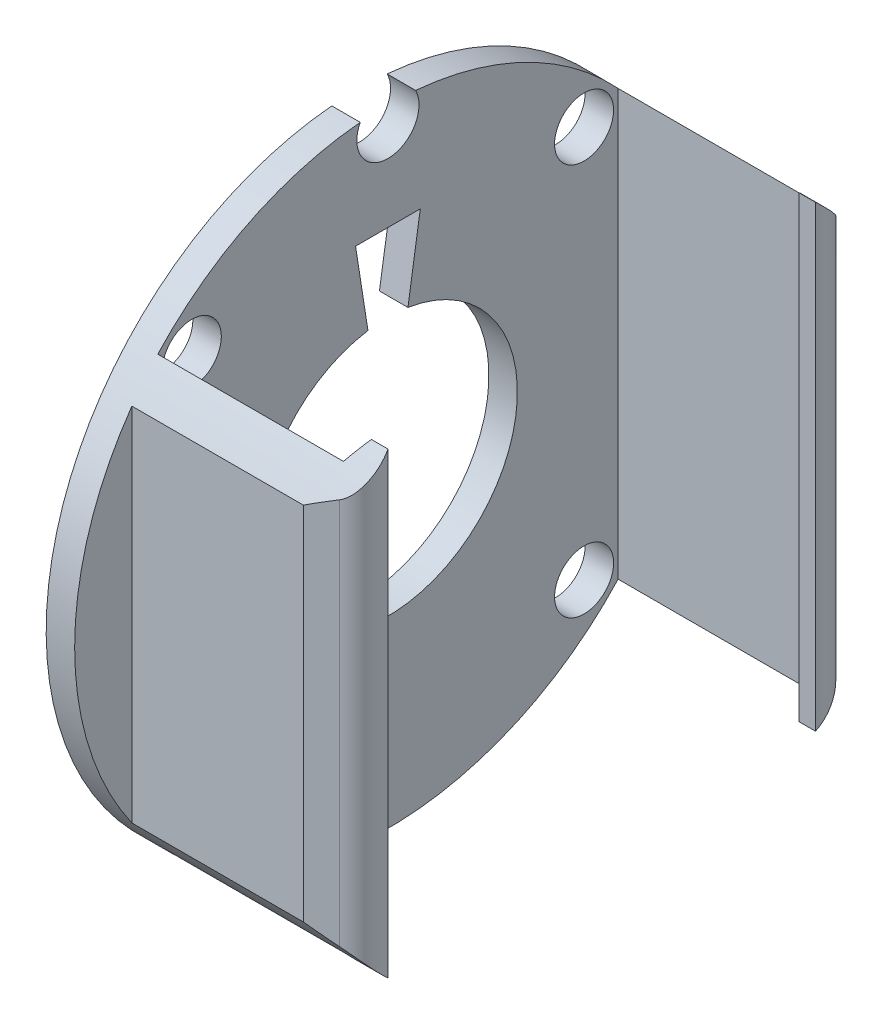
from build123d import *

# Parameters (mm, degrees)
SKETCH1_R           = 60.5
BOSS_EXTRUDE1_DEPTH = 5.5
SKETCH2_R           = 5.7
SKETCH2_R_2         = 25
CUT_EXTRUDE1_DEPTH  = 86.736514975
BOSS_EXTRUDE2_DEPTH = 38.1
BOSS_EXTRUDE3_DEPTH = 5
CHAMFER1_SIZE       = 10
CHAMFER1_SIZE_2     = 3.639702343
CHAMFER2_SIZE       = 10
CHAMFER2_SIZE2      = 3.639702343
CHAMFER3_SIZE       = 1.819851171
CHAMFER3_SIZE_2     = 5
CHAMFER4_SIZE       = 5
CHAMFER4_SIZE_2     = 1.819851171
FILLET1_R           = 5
CHAMFER5_SIZE       = 3.213333015
CHAMFER5_SIZE_2     = 2.25
CHAMFER6_SIZE       = 2.25
CHAMFER6_SIZE_2     = 3.213333015
SKETCH5_R           = 6
CUT_EXTRUDE2_DEPTH  = 96.112299108


with BuildPart() as part:
    # Sketch1 → Boss-Extrude1 (new body)
    with BuildSketch(Plane(origin=(0, 0, 0), x_dir=(0, 0, -1), z_dir=(1, 0, 0))):
        Circle(SKETCH1_R)
    extrude(amount=BOSS_EXTRUDE1_DEPTH)

    # Sketch2 → Cut-Extrude1 (cut, through all)
    with BuildSketch(Plane(origin=(5.5, 0, 0), x_dir=(0, 0, -1), z_dir=(1, 0, 0))):
        with Locations((-37.875, 37.875)):
            Circle(SKETCH2_R)
        with Locations(Location((37.875, 37.875, 0), (0, 0, 180))):
            Circle(SKETCH2_R)
        with Locations((37.875, -37.875)):
            Circle(SKETCH2_R)
        with Locations(Location((-37.875, -37.875, 0), (0, 0, 180))):
            Circle(SKETCH2_R)
        Circle(SKETCH2_R_2)
    extrude(amount=-CUT_EXTRUDE1_DEPTH, mode=Mode.SUBTRACT)

    # Sketch3 → Boss-Extrude2 (add)
    with BuildSketch(Plane(origin=(5.5, 0, 0), x_dir=(0, 0, -1), z_dir=(1, 0, 0))):
        with BuildLine():
            ThreePointArc((-44.45, 41.042021149), (-47.05176845, 38.03131717), (-49.45, 34.856097028))
            Line((-49.45, 34.856097028), (-49.45, -34.856097028))
            ThreePointArc((-49.45, -34.856097028), (-47.05176845, -38.03131717), (-44.45, -41.042021149))
            Line((-44.45, -41.042021149), (-44.45, 41.042021149))
        make_face()
        with BuildLine():
            ThreePointArc((49.45, 34.856097028), (47.05176845, 38.03131717), (44.45, 41.042021149))
            Line((44.45, 41.042021149), (44.45, -41.042021149))
            ThreePointArc((44.45, -41.042021149), (47.05176845, -38.03131717), (49.45, -34.856097028))
            Line((49.45, -34.856097028), (49.45, 34.856097028))
        make_face()
    extrude(amount=BOSS_EXTRUDE2_DEPTH)

    # Sketch4 → Boss-Extrude3 (add)
    with BuildSketch(Plane(origin=(43.6, 0, 0), x_dir=(0, 0, -1), z_dir=(1, 0, 0))):
        with BuildLine():
            Line((-41.275, -44.233747015), (-41.275, 44.233747015))
            ThreePointArc((-41.275, 44.233747015), (-42.892198414, 42.667426865), (-44.45, 41.042021149))
            Line((-44.45, 41.042021149), (-44.45, -41.042021149))
            ThreePointArc((-44.45, -41.042021149), (-42.892198414, -42.667426865), (-41.275, -44.233747015))
        make_face()
        with BuildLine():
            Line((-49.45, 34.856097028), (-49.45, -34.856097028))
            ThreePointArc((-49.45, -34.856097028), (-47.05176845, -38.03131717), (-44.45, -41.042021149))
            Line((-44.45, -41.042021149), (-44.45, 41.042021149))
            ThreePointArc((-44.45, 41.042021149), (-47.05176845, 38.03131717), (-49.45, 34.856097028))
        make_face()
        with BuildLine():
            Line((49.45, -34.856097028), (49.45, 34.856097028))
            ThreePointArc((49.45, 34.856097028), (45.604182769, 39.755609842), (41.275, 44.233747015))
            Line((41.275, 44.233747015), (41.275, -44.233747015))
            ThreePointArc((41.275, -44.233747015), (45.604182769, -39.755609842), (49.45, -34.856097028))
        make_face()
    extrude(amount=BOSS_EXTRUDE3_DEPTH)

    # Chamfer1
    # the kernel refuses this chamfer: 10, 3.639702343 mm, written as the material it takes off along each edge
    with BuildSketch(Plane(origin=(48.6, 60.798044353, 49.45), x_dir=(-0.9999130865277315, 0, 0.013184058198646176), z_dir=(0, -1, 0))) as chamfer1_piece_1:
        Polygon((CHAMFER1_SIZE * 0.999913086528, CHAMFER1_SIZE * 0.0131840581986), (-CHAMFER1_SIZE_2 * 0.0131840581974, CHAMFER1_SIZE_2 * 0.999913086435), (0, 0), align=None)
    extrude(amount=121.596088706, mode=Mode.SUBTRACT)

    # Chamfer2
    chamfer2_edges = [part.edges().sort_by_distance(p)[0] for p in [
        (48.6, 0, -49.45),
    ]]
    chamfer2_side = [part.faces().sort_by_distance(p)[0] for p in [
        (27.05, 0, -49.45),
    ]]
    chamfer(chamfer2_edges, length=CHAMFER2_SIZE, length2=CHAMFER2_SIZE2, reference=chamfer2_side[0])

    # Chamfer3
    # the kernel refuses this chamfer: 5, 1.819851171 mm, written as the material it takes off along each edge
    with BuildSketch(Plane(origin=(48.6, -57.204720678, 41.275), x_dir=(-0.9950833631817487, 0, -0.09904090225204971), z_dir=(0, 1, 0))) as chamfer3_piece_1:
        Polygon((CHAMFER3_SIZE * 0.995083363363, CHAMFER3_SIZE * 0.0990409022701), (-CHAMFER3_SIZE_2 * 0.099040902252, CHAMFER3_SIZE_2 * 0.995083363182), (0, 0), align=None)
    extrude(amount=114.409441356, mode=Mode.SUBTRACT)

    # Chamfer4
    # the kernel refuses this chamfer: 5, 1.819851171 mm, written as the material it takes off along each edge
    with BuildSketch(Plane(origin=(48.6, 57.204720678, -41.275), x_dir=(0.013184058198646176, 0, -0.9999130865277315), z_dir=(0, -1, 0))) as chamfer4_piece_1:
        Polygon((CHAMFER4_SIZE * 0.999913086528, -CHAMFER4_SIZE * 0.0131840581986), (-CHAMFER4_SIZE_2 * 0.013184058201, -CHAMFER4_SIZE_2 * 0.99991308671), (0, 0), align=None)
    extrude(amount=114.409441356, mode=Mode.SUBTRACT)

    # Fillet1
    # the kernel refuses this fillet: 5 mm, written as the material it takes off along each edge
    with BuildSketch(Plane(origin=(48.450647546, -51.951472504, -45.864657505), x_dir=(-0.9396926207859081, 0, -0.34202014332566955), z_dir=(0, 1, 0))) as fillet1_piece_1:
        with BuildLine():
            CenterArc((4.998659123, 5), FILLET1_R, 181.326957093, 88.673042907)
            Line((0, 4.8842115), (-0.099973182, 4.88189573))
            ThreePointArc((-0.099973182, 4.88189573), (-0.1, 2.44210575), (-0.1, 0))
            Line((-0.1, 0), (0, -0.1))
            Line((0, -0.1), (4.998659123, -0.1))
            Line((4.998659123, -0.1), (4.998659123, 0))
        make_face()
    extrude(amount=103.902945009, mode=Mode.SUBTRACT)
    with BuildSketch(Plane(origin=(48.450647546, -51.951472504, 45.864657505), x_dir=(-0.9396926207857893, 0, 0.3420201433259962), z_dir=(0, 1, 0))) as fillet1_piece_2:
        with BuildLine():
            CenterArc((4.998659123, -5), FILLET1_R, 90, 88.673042907)
            Line((0, -4.8842115), (-0.099973182, -4.88189573))
            ThreePointArc((-0.099973182, -4.88189573), (-0.1, -2.44210575), (-0.1, 0))
            Line((-0.1, 0), (0, 0.1))
            Line((0, 0.1), (4.998659123, 0.1))
            Line((4.998659123, 0.1), (4.998659123, 0))
        make_face()
    extrude(amount=103.902945009, mode=Mode.SUBTRACT)

    # Chamfer5
    # the kernel refuses this chamfer: 3.213333015, 2.25 mm, written as the material it adds along each edge
    with BuildSketch(Plane(origin=(43.6, -49.340621494, 44.45), x_dir=(0.02220967419845722, 0, -0.99975333476413), z_dir=(0, 1, 0))) as chamfer5_piece_1_section:
        Polygon((CHAMFER5_SIZE * 0.999753334817, CHAMFER5_SIZE * 0.0222096741996), (-CHAMFER5_SIZE_2 * 0.0222096741985, CHAMFER5_SIZE_2 * 0.999753334764), (0, 0), align=None)
    chamfer5_piece_1 = extrude(amount=98.681242988, mode=Mode.PRIVATE)
    chamfer5_piece_1 = chamfer5_piece_1 & Plane(origin=(42.872647852, 0, 0), x_dir=(0, 0, -1), z_dir=(-1, 0, 0)) * Cylinder(60.5, 211, mode=Mode.PRIVATE)
    chamfer5_piece_1 = split(chamfer5_piece_1, bisect_by=Plane(origin=(42.872647852, 1e-09, 41.275), z_dir=(0, 0, 1)), keep=Keep.TOP, mode=Mode.PRIVATE)
    add(chamfer5_piece_1)

    # Chamfer6
    # the kernel refuses this chamfer: 3.213333015, 2.25 mm, written as the material it adds along each edge
    with BuildSketch(Plane(origin=(43.6, 49.340621494, -44.45), x_dir=(-0.9989750717851553, 0, -0.04526373771402063), z_dir=(0, -1, 0))) as chamfer6_piece_1_section:
        Polygon((CHAMFER6_SIZE * 0.998975071785, -CHAMFER6_SIZE * 0.045263737714), (-CHAMFER6_SIZE_2 * 0.0452637377164, -CHAMFER6_SIZE_2 * 0.998975071838), (0, 0), align=None)
    chamfer6_piece_1 = extrude(amount=98.681242988, mode=Mode.PRIVATE)
    chamfer6_piece_1 = chamfer6_piece_1 & Plane(origin=(42.872647852, 0, 0), x_dir=(0, 0, -1), z_dir=(-1, 0, 0)) * Cylinder(60.5, 211, mode=Mode.PRIVATE)
    chamfer6_piece_1 = split(chamfer6_piece_1, bisect_by=Plane(origin=(42.872647852, -1e-09, -41.275), z_dir=(0, 0, -1)), keep=Keep.TOP, mode=Mode.PRIVATE)
    add(chamfer6_piece_1)

    # Sketch5 → Cut-Extrude2 (cut, through all)
    with BuildSketch(Plane(origin=(5.5, 0, 0), x_dir=(0, 0, -1), z_dir=(1, 0, 0))):
        with Locations((0, 57.537769206)):
            Circle(SKETCH5_R)
        Polygon((0, 0), (-6.25, 40), (6.25, 40), align=None)
    extrude(amount=-CUT_EXTRUDE2_DEPTH, mode=Mode.SUBTRACT)


solid = part.part
